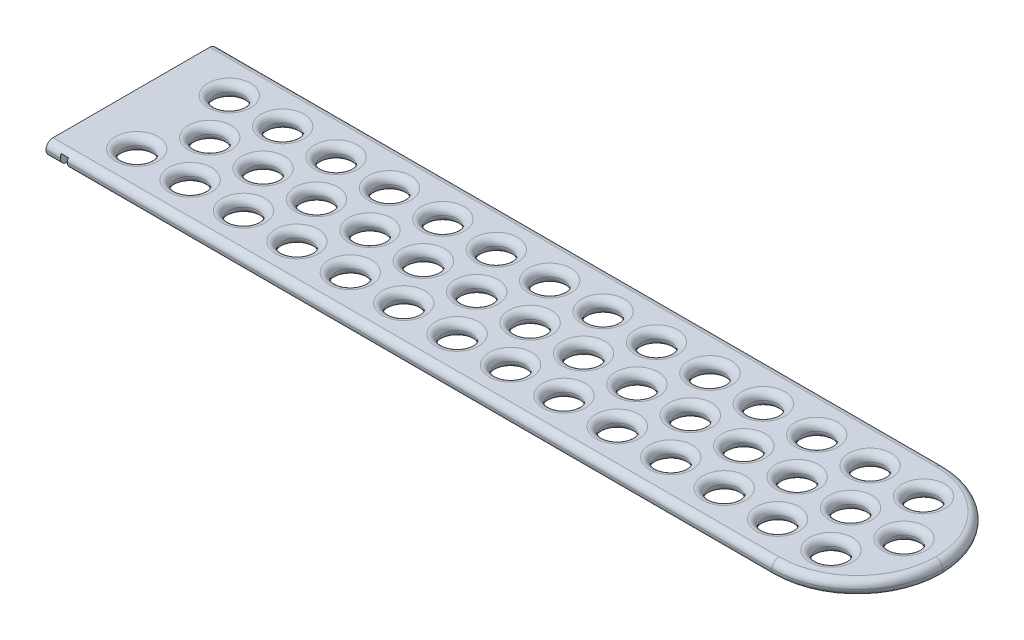
from build123d import *

# Parameters (mm, degrees)
SKETCH1_W               = 115
SKETCH1_H               = 24
BOSS_EXTRUDE1_DEPTH     = 2
FILLET4_R               = 12
SKETCH4_R               = 2
CUT_EXTRUDE2_DEPTH      = 139.262669437
FILLET3_R               = 1
CUT_EXTRUDE6_DEPTH      = 139.262669437
CUT_EXTRUDE6_DEPTH_BACK = 139.262669437
SKETCH11_W              = 1
SKETCH11_H              = 24
SKETCH12_W              = 1
SKETCH12_H              = 24
CUT_EXTRUDE7_DEPTH      = 1.5


with BuildPart() as part:
    # Sketch1 → Boss-Extrude1 (new body)
    with BuildSketch(Plane(origin=(0, 0, 0), x_dir=(1, 0, 0), z_dir=(0, 1, 0))):
        with Locations((80.226416348, 0)):
            Rectangle(SKETCH1_W, SKETCH1_H)
    extrude(amount=BOSS_EXTRUDE1_DEPTH)

    # Fillet4
    fillet4_edges = [part.edges().sort_by_distance(p)[0] for p in [
        (137.726416348, 1, 12),
        (137.726416348, 1, -12),
    ]]
    fillet(fillet4_edges, radius=FILLET4_R - 0.0001)  # a hair under: the kernel refuses the full size

    # Sketch4 → Cut-Extrude2 (cut, through all)
    with BuildSketch(Plane(origin=(0, 2, 0), x_dir=(1, 0, 0), z_dir=(0, 1, 0))):
        with Locations(Location((30.973639598, 6.5, 0), (0, 0, 270))):
            Circle(SKETCH4_R)
        with Locations(Location((34.726416348, 0, 0), (0, 0, 270))):
            Circle(SKETCH4_R)
        with Locations(Location((30.973639598, -6.5, 0), (0, 0, 270))):
            Circle(SKETCH4_R)
        with Locations(Location((42.229193097, 0, 0), (0, 0, 270))):
            Circle(SKETCH4_R)
        with Locations(Location((38.476416348, 6.5, 0), (0, 0, 270))):
            Circle(SKETCH4_R)
        with Locations(Location((38.476416348, -6.5, 0), (0, 0, 270))):
            Circle(SKETCH4_R)
        with Locations(Location((49.731969847, 0, 0), (0, 0, 270))):
            Circle(SKETCH4_R)
        with Locations(Location((45.979193097, 6.5, 0), (0, 0, 270))):
            Circle(SKETCH4_R)
        with Locations(Location((45.979193097, -6.5, 0), (0, 0, 270))):
            Circle(SKETCH4_R)
        with Locations(Location((57.234746597, 0, 0), (0, 0, 270))):
            Circle(SKETCH4_R)
        with Locations(Location((53.481969847, 6.5, 0), (0, 0, 270))):
            Circle(SKETCH4_R)
        with Locations(Location((53.481969847, -6.5, 0), (0, 0, 270))):
            Circle(SKETCH4_R)
        with Locations(Location((64.737523346, 0, 0), (0, 0, 270))):
            Circle(SKETCH4_R)
        with Locations(Location((60.984746597, 6.5, 0), (0, 0, 270))):
            Circle(SKETCH4_R)
        with Locations(Location((60.984746597, -6.5, 0), (0, 0, 270))):
            Circle(SKETCH4_R)
        with Locations(Location((72.240300096, 0, 0), (0, 0, 270))):
            Circle(SKETCH4_R)
        with Locations(Location((68.487523346, 6.5, 0), (0, 0, 270))):
            Circle(SKETCH4_R)
        with Locations(Location((68.487523346, -6.5, 0), (0, 0, 270))):
            Circle(SKETCH4_R)
        with Locations(Location((79.743076846, 0, 0), (0, 0, 270))):
            Circle(SKETCH4_R)
        with Locations(Location((75.990300096, 6.5, 0), (0, 0, 270))):
            Circle(SKETCH4_R)
        with Locations(Location((75.990300096, -6.5, 0), (0, 0, 270))):
            Circle(SKETCH4_R)
        with Locations(Location((87.245853596, 0, 0), (0, 0, 270))):
            Circle(SKETCH4_R)
        with Locations(Location((83.493076846, 6.5, 0), (0, 0, 270))):
            Circle(SKETCH4_R)
        with Locations(Location((83.493076846, -6.5, 0), (0, 0, 270))):
            Circle(SKETCH4_R)
        with Locations(Location((94.748630345, 0, 0), (0, 0, 270))):
            Circle(SKETCH4_R)
        with Locations(Location((90.995853596, 6.5, 0), (0, 0, 270))):
            Circle(SKETCH4_R)
        with Locations(Location((90.995853596, -6.5, 0), (0, 0, 270))):
            Circle(SKETCH4_R)
        with Locations(Location((102.251407095, 0, 0), (0, 0, 270))):
            Circle(SKETCH4_R)
        with Locations(Location((98.498630345, 6.5, 0), (0, 0, 270))):
            Circle(SKETCH4_R)
        with Locations(Location((98.498630345, -6.5, 0), (0, 0, 270))):
            Circle(SKETCH4_R)
        with Locations(Location((109.754183845, 0, 0), (0, 0, 270))):
            Circle(SKETCH4_R)
        with Locations(Location((106.001407095, 6.5, 0), (0, 0, 270))):
            Circle(SKETCH4_R)
        with Locations(Location((106.001407095, -6.5, 0), (0, 0, 270))):
            Circle(SKETCH4_R)
        with Locations(Location((117.256960595, 0, 0), (0, 0, 270))):
            Circle(SKETCH4_R)
        with Locations(Location((113.504183845, 6.5, 0), (0, 0, 270))):
            Circle(SKETCH4_R)
        with Locations(Location((113.504183845, -6.5, 0), (0, 0, 270))):
            Circle(SKETCH4_R)
        with Locations(Location((124.759737344, 0, 0), (0, 0, 270))):
            Circle(SKETCH4_R)
        with Locations(Location((121.006960595, 6.5, 0), (0, 0, 270))):
            Circle(SKETCH4_R)
        with Locations(Location((121.006960595, -6.5, 0), (0, 0, 270))):
            Circle(SKETCH4_R)
        with Locations(Location((132.262514094, 0, 0), (0, 0, 270))):
            Circle(SKETCH4_R)
        with Locations(Location((128.509737344, 6.5, 0), (0, 0, 270))):
            Circle(SKETCH4_R)
        with Locations(Location((128.509737344, -6.5, 0), (0, 0, 270))):
            Circle(SKETCH4_R)
    extrude(amount=-CUT_EXTRUDE2_DEPTH, mode=Mode.SUBTRACT)

    # Fillet3
    fillet3_edges = [part.edges().sort_by_distance(p)[0] for p in [
        (74.226466348, 0, 12),
        (74.226466348, 0, -12),
        (30.973639598, 0, -8.5),
        (113.504183845, 0, 4.5),
        (117.256960595, 0, -2),
        (113.504183845, 0, -8.5),
        (60.984746597, 0, -8.5),
        (53.481969847, 0, 4.5),
        (57.234746597, 0, -2),
        (53.481969847, 0, -8.5),
        (72.240300096, 0, -2),
        (68.487523346, 0, -8.5),
        (60.984746597, 0, 4.5),
        (64.737523346, 0, -2),
        (42.229193097, 0, -2),
        (38.476416348, 0, -8.5),
        (30.973639598, 0, 4.5),
        (34.726416348, 0, -2),
        (45.979193097, 0, 4.5),
        (49.731969847, 0, -2),
        (45.979193097, 0, -8.5),
        (38.476416348, 0, 4.5),
        (102.251407095, 0, -2),
        (98.498630345, 0, -8.5),
        (90.995853596, 0, 4.5),
        (94.748630345, 0, -2),
        (106.001407095, 0, 4.5),
        (109.754183845, 0, -2),
        (106.001407095, 0, -8.5),
        (98.498630345, 0, 4.5),
        (75.990300096, 0, 4.5),
        (79.743076846, 0, -2),
        (75.990300096, 0, -8.5),
        (68.487523346, 0, 4.5),
        (90.995853596, 0, -8.5),
        (83.493076846, 0, 4.5),
        (87.245853596, 0, -2),
        (83.493076846, 0, -8.5),
        (74.226466348, 2, 12),
        (74.226466348, 2, -12),
        (30.973639598, 2, -8.5),
        (113.504183845, 2, 4.5),
        (117.256960595, 2, -2),
        (113.504183845, 2, -8.5),
        (60.984746597, 2, -8.5),
        (53.481969847, 2, 4.5),
        (57.234746597, 2, -2),
        (53.481969847, 2, -8.5),
        (72.240300096, 2, -2),
        (68.487523346, 2, -8.5),
        (60.984746597, 2, 4.5),
        (64.737523346, 2, -2),
        (42.229193097, 2, -2),
        (38.476416348, 2, -8.5),
        (30.973639598, 2, 4.5),
        (34.726416348, 2, -2),
        (45.979193097, 2, 4.5),
        (49.731969847, 2, -2),
        (45.979193097, 2, -8.5),
        (38.476416348, 2, 4.5),
        (102.251407095, 2, -2),
        (98.498630345, 2, -8.5),
        (90.995853596, 2, 4.5),
        (94.748630345, 2, -2),
        (106.001407095, 2, 4.5),
        (109.754183845, 2, -2),
        (106.001407095, 2, -8.5),
        (98.498630345, 2, 4.5),
        (75.990300096, 2, 4.5),
        (79.743076846, 2, -2),
        (75.990300096, 2, -8.5),
        (68.487523346, 2, 4.5),
        (90.995853596, 2, -8.5),
        (83.493076846, 2, 4.5),
        (87.245853596, 2, -2),
        (83.493076846, 2, -8.5),
        (128.509737344, 0, -8.5),
        (128.509737344, 2, -8.5),
        (22.726416348, 0, 0),
        (22.726416348, 2, 0),
        (132.262514094, 0, -2),
        (121.006960595, 0, 4.5),
        (128.509737344, 0, 4.5),
        (121.006960595, 0, -8.5),
        (124.759737344, 0, -2),
        (132.262514094, 2, -2),
        (121.006960595, 2, 4.5),
        (128.509737344, 2, 4.5),
        (121.006960595, 2, -8.5),
        (124.759737344, 2, -2),
        (134.211727011, 0, 8.485310664),
        (134.211727011, 0, -8.485310664),
        (134.211727011, 2, -8.485310664),
        (134.211727011, 2, 8.485310664),
    ]]
    fillet(fillet3_edges, radius=FILLET3_R - 0.0001)  # a hair under: the kernel refuses the full size

    # Sketch11 → Cut-Extrude6 (cut, two sides: drawn at the far end of the back side and taken through both)
    with BuildSketch(Plane(origin=(0, 2, 0), x_dir=(1, 0, 0), z_dir=(0, 1, 0)).offset(-CUT_EXTRUDE6_DEPTH_BACK)):
        with Locations((23.226416348, 0)):
            Rectangle(SKETCH11_W, SKETCH11_H)
    extrude(amount=CUT_EXTRUDE6_DEPTH + CUT_EXTRUDE6_DEPTH_BACK, mode=Mode.SUBTRACT)

    # Sketch12 → Cut-Extrude7 (cut)
    with BuildSketch(Plane.XZ):
        with Locations((26.226416348, 0)):
            Rectangle(SKETCH12_W, SKETCH12_H)
    extrude(amount=-CUT_EXTRUDE7_DEPTH, mode=Mode.SUBTRACT)


solid = part.part
